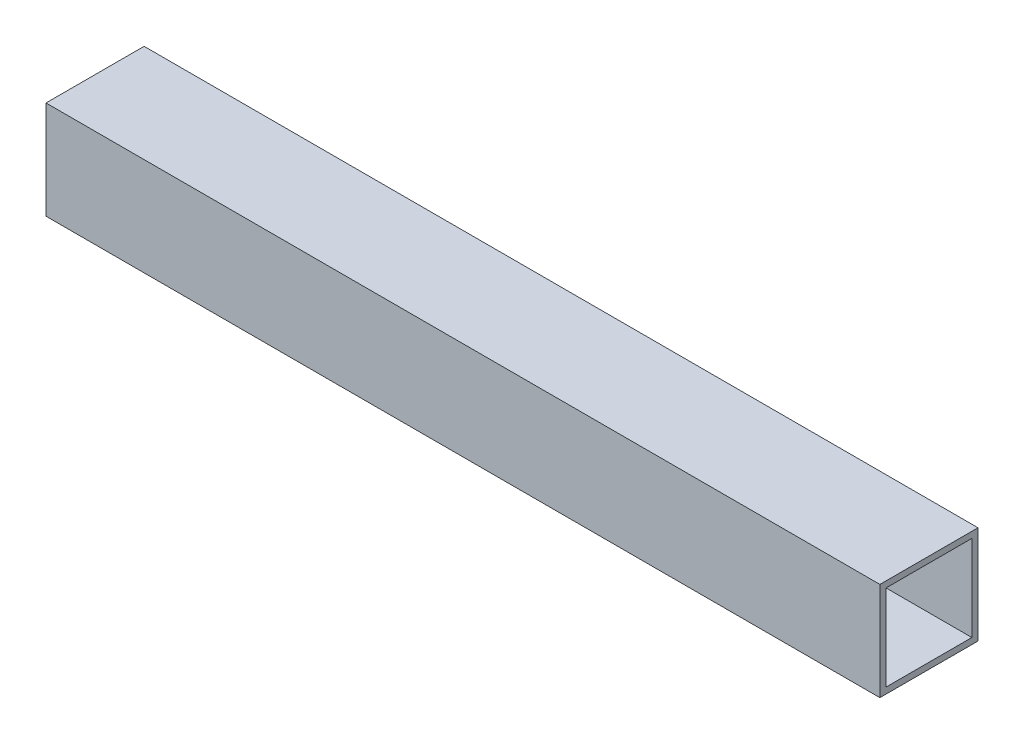
from build123d import *

# Parameters (mm, degrees)
SKETCH1_W           = 25.4
SKETCH1_H           = 25.4
SKETCH1_W_2         = 22.225
SKETCH1_H_2         = 22.225
EXTRUDE_THIN1_DEPTH = 215.9


with BuildPart() as part:
    # Sketch1 → Extrude-Thin1 (new body)
    with BuildSketch(Plane(origin=(0, 0, 0), x_dir=(0, 0, -1), z_dir=(1, 0, 0))):
        Rectangle(SKETCH1_W, SKETCH1_H)
        Rectangle(SKETCH1_W_2, SKETCH1_H_2, mode=Mode.SUBTRACT)
    extrude(amount=EXTRUDE_THIN1_DEPTH)


solid = part.part
